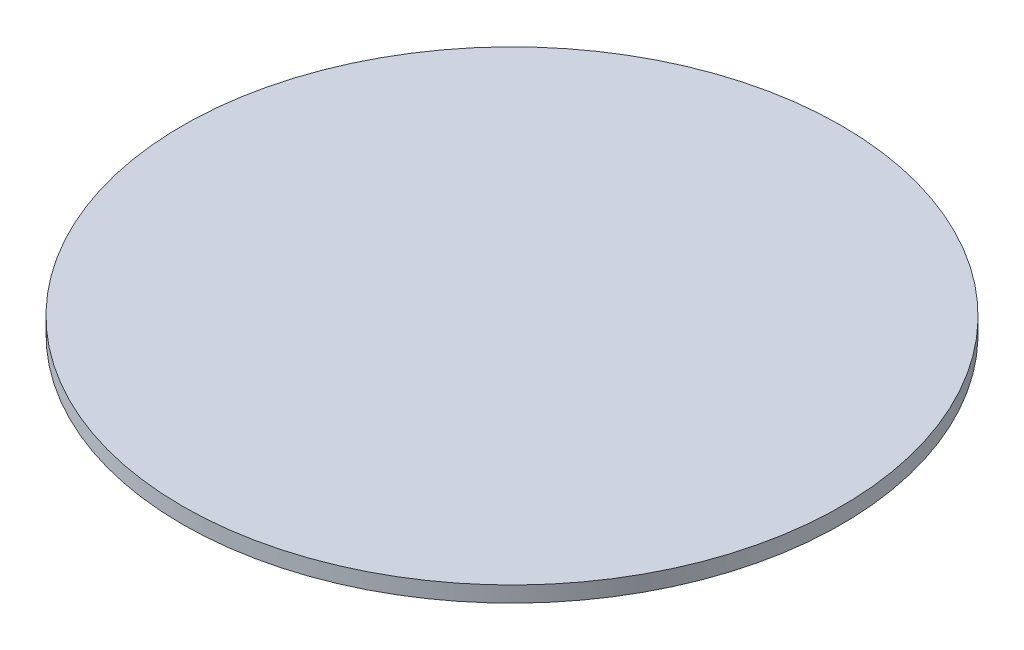
from build123d import *

# Parameters (mm, degrees)
FRONT_W       = 20.95
FRONT_H       = 1
SKETCH1_W     = 4
SKETCH1_H     = 1
HOLDERS_DEPTH = 1.8


with BuildPart() as part:
    # Front → Base (revolve)
    with BuildSketch(Plane.XY):
        with Locations((-10.475, 0)):
            Rectangle(FRONT_W, FRONT_H)
    revolve(axis=Axis((0, 0, 0), (0, 1, 0)))

    # Sketch1 → Holders (add)
    with BuildSketch(Plane.XZ.offset(0.5)):
        with Locations((0, 15)):
            Rectangle(SKETCH1_W, SKETCH1_H)
        with Locations((0, -15)):
            Rectangle(SKETCH1_W, SKETCH1_H)
    extrude(amount=HOLDERS_DEPTH)


solid = part.part
